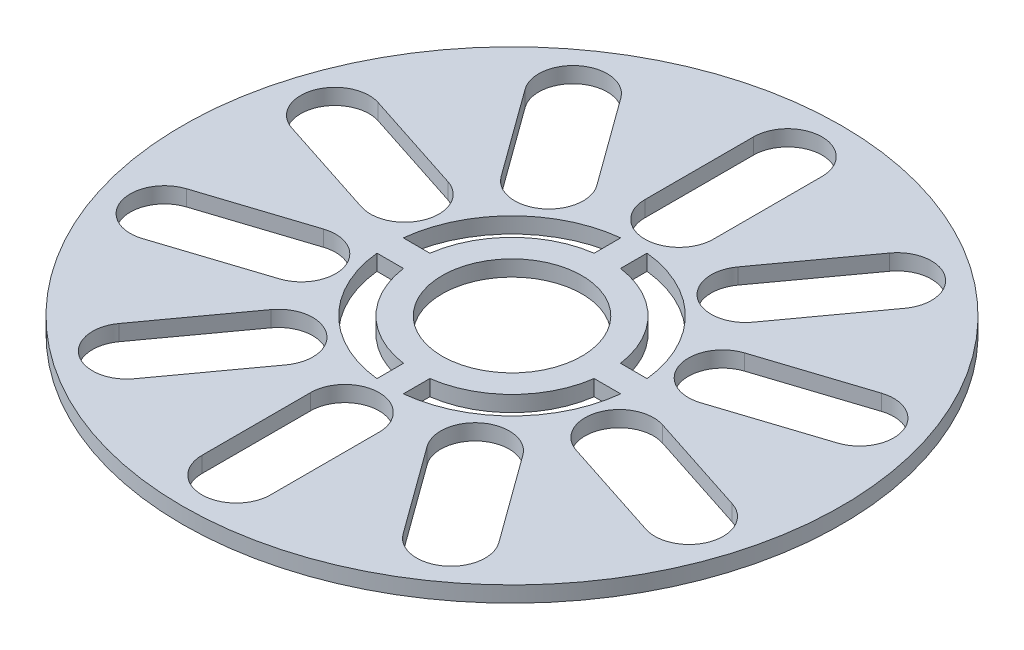
from build123d import *

# Parameters (mm, degrees)
SKETCH1_R           = 62.5
SKETCH1_R_2         = 13.25
BOSS_EXTRUDE1_DEPTH = 3


with BuildPart() as part:
    # Sketch1 → Boss-Extrude1 (new body)
    with BuildSketch(Plane(origin=(0, 0, 0), x_dir=(1, 0, 0), z_dir=(0, 1, 0))):
        Circle(SKETCH1_R)
        Circle(SKETCH1_R_2, mode=Mode.SUBTRACT)
        with BuildLine():
            Line((-2.5, 18.07795619), (-2.5, 23.115200626))
            ThreePointArc((-2.5, 23.115200626), (-16.440232663, 16.440232663), (-23.115200626, 2.5))
            Line((-23.115200626, 2.5), (-18.07795619, 2.5))
            ThreePointArc((-18.07795619, 2.5), (-12.904698757, 12.904698757), (-2.5, 18.07795619))
        make_face(mode=Mode.SUBTRACT)
        with BuildLine():
            Line((2.5, 18.07795619), (2.5, 23.115200626))
            ThreePointArc((2.5, 23.115200626), (16.440232663, 16.440232663), (23.115200626, 2.5))
            Line((23.115200626, 2.5), (18.07795619, 2.5))
            ThreePointArc((18.07795619, 2.5), (12.904698757, 12.904698757), (2.5, 18.07795619))
        make_face(mode=Mode.SUBTRACT)
        with BuildLine():
            Line((18.07795619, -2.5), (23.115200626, -2.5))
            ThreePointArc((23.115200626, -2.5), (16.440232663, -16.440232663), (2.5, -23.115200626))
            Line((2.5, -23.115200626), (2.5, -18.07795619))
            ThreePointArc((2.5, -18.07795619), (12.904698757, -12.904698757), (18.07795619, -2.5))
        make_face(mode=Mode.SUBTRACT)
        with BuildLine():
            Line((-2.5, -18.07795619), (-2.5, -23.115200626))
            ThreePointArc((-2.5, -23.115200626), (-16.440232663, -16.440232663), (-23.115200626, -2.5))
            Line((-23.115200626, -2.5), (-18.07795619, -2.5))
            ThreePointArc((-18.07795619, -2.5), (-12.904698757, -12.904698757), (-2.5, -18.07795619))
        make_face(mode=Mode.SUBTRACT)
        with BuildLine():
            Line((-6.5, 31.7), (-6.5, 52.3))
            ThreePointArc((-6.5, 52.3), (0, 58.8), (6.5, 52.3))
            Line((6.5, 52.3), (6.5, 31.7))
            ThreePointArc((6.5, 31.7), (0, 25.2), (-6.5, 31.7))
        make_face(mode=Mode.SUBTRACT)
        with BuildLine():
            Line((23.891402961, 21.825234582), (35.999779158, 38.490984666))
            ThreePointArc((35.999779158, 38.490984666), (34.561772835, 47.570199269), (25.482558231, 46.132192946))
            Line((25.482558231, 46.132192946), (13.374182034, 29.466442862))
            ThreePointArc((13.374182034, 29.466442862), (14.812188358, 20.387228258), (23.891402961, 21.825234582))
        make_face(mode=Mode.SUBTRACT)
        with BuildLine():
            Line((32.15710203, 3.613971366), (51.748866266, 9.97972145))
            ThreePointArc((51.748866266, 9.97972145), (55.922123158, 18.170199269), (47.731645339, 22.343456162))
            Line((47.731645339, 22.343456162), (28.139881103, 15.977706078))
            ThreePointArc((28.139881103, 15.977706078), (23.966624211, 7.787228258), (32.15710203, 3.613971366))
        make_face(mode=Mode.SUBTRACT)
        with BuildLine():
            Line((28.139881103, -15.977706078), (47.731645339, -22.343456162))
            ThreePointArc((47.731645339, -22.343456162), (55.922123158, -18.170199269), (51.748866266, -9.97972145))
            Line((51.748866266, -9.97972145), (32.15710203, -3.613971366))
            ThreePointArc((32.15710203, -3.613971366), (23.966624211, -7.787228258), (28.139881103, -15.977706078))
        make_face(mode=Mode.SUBTRACT)
        with BuildLine():
            Line((13.374182034, -29.466442862), (25.482558231, -46.132192946))
            ThreePointArc((25.482558231, -46.132192946), (34.561772835, -47.570199269), (35.999779158, -38.490984666))
            Line((35.999779158, -38.490984666), (23.891402961, -21.825234582))
            ThreePointArc((23.891402961, -21.825234582), (14.812188358, -20.387228258), (13.374182034, -29.466442862))
        make_face(mode=Mode.SUBTRACT)
        with BuildLine():
            Line((-6.5, -31.7), (-6.5, -52.3))
            ThreePointArc((-6.5, -52.3), (0, -58.8), (6.5, -52.3))
            Line((6.5, -52.3), (6.5, -31.7))
            ThreePointArc((6.5, -31.7), (0, -25.2), (-6.5, -31.7))
        make_face(mode=Mode.SUBTRACT)
        with BuildLine():
            Line((-23.891402961, -21.825234582), (-35.999779158, -38.490984666))
            ThreePointArc((-35.999779158, -38.490984666), (-34.561772835, -47.570199269), (-25.482558231, -46.132192946))
            Line((-25.482558231, -46.132192946), (-13.374182034, -29.466442862))
            ThreePointArc((-13.374182034, -29.466442862), (-14.812188358, -20.387228258), (-23.891402961, -21.825234582))
        make_face(mode=Mode.SUBTRACT)
        with BuildLine():
            Line((-32.15710203, -3.613971366), (-51.748866266, -9.97972145))
            ThreePointArc((-51.748866266, -9.97972145), (-55.922123158, -18.170199269), (-47.731645339, -22.343456162))
            Line((-47.731645339, -22.343456162), (-28.139881103, -15.977706078))
            ThreePointArc((-28.139881103, -15.977706078), (-23.966624211, -7.787228258), (-32.15710203, -3.613971366))
        make_face(mode=Mode.SUBTRACT)
        with BuildLine():
            Line((-28.139881103, 15.977706078), (-47.731645339, 22.343456162))
            ThreePointArc((-47.731645339, 22.343456162), (-55.922123158, 18.170199269), (-51.748866266, 9.97972145))
            Line((-51.748866266, 9.97972145), (-32.15710203, 3.613971366))
            ThreePointArc((-32.15710203, 3.613971366), (-23.966624211, 7.787228258), (-28.139881103, 15.977706078))
        make_face(mode=Mode.SUBTRACT)
        with BuildLine():
            Line((-13.374182034, 29.466442862), (-25.482558231, 46.132192946))
            ThreePointArc((-25.482558231, 46.132192946), (-34.561772835, 47.570199269), (-35.999779158, 38.490984666))
            Line((-35.999779158, 38.490984666), (-23.891402961, 21.825234582))
            ThreePointArc((-23.891402961, 21.825234582), (-14.812188358, 20.387228258), (-13.374182034, 29.466442862))
        make_face(mode=Mode.SUBTRACT)
    extrude(amount=BOSS_EXTRUDE1_DEPTH)


solid = part.part
